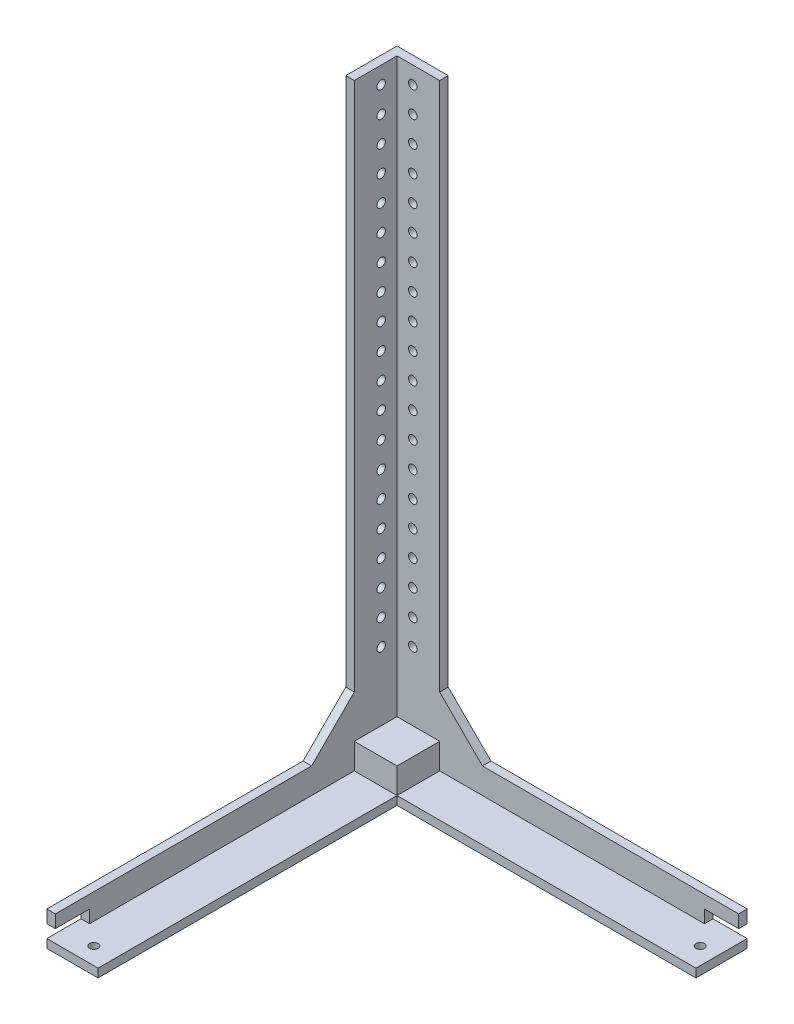
from build123d import *

# Parameters (mm, degrees)
EXTRUDE_2_DEPTH          = 10
EXTRUDE_3_DEPTH          = 40
EXTRUDE_4_DEPTH          = 700
SKETCH_13_W              = 60
SKETCH_13_H              = 60
EXTRUDE_7_DEPTH          = 30
EXTRUDE_1_DEPTH          = 40
EXTRUDE_8_DEPTH          = 10
EXTRUDE_9_DEPTH          = 10
SKETCH_36_R              = 5
CUT_EXTRUDE_1_DEPTH      = 10
PATTERN_LINEAR_1_COUNT   = 20
PATTERN_LINEAR_1_PITCH   = 30
SKETCH_37_R              = 5
CUT_EXTRUDE_2_DEPTH      = 10
PATTERN_LINEAR_2_COUNT   = 20
PATTERN_LINEAR_2_PITCH   = 30
CUT_EXTRUDE_3_DEPTH      = 901
CUT_EXTRUDE_3_DEPTH_BACK = 901
SKETCH_38_R              = 5
SKETCH_39_W              = 10
SKETCH_39_H              = 15
CUT_EXTRUDE_4_DEPTH      = 40
SKETCH_40_W              = 10
SKETCH_40_H              = 15
CUT_EXTRUDE_5_DEPTH      = 40


# Read off the part's stored shape, not the designer's step: 拉伸-薄壁1
with BuildPart() as part:
    # 草图3 → 凸台-拉伸2 (new body)
    with BuildSketch(Plane(origin=(0, 0, 0), x_dir=(1, 0, 0), z_dir=(0, 1, 0))):
        Polygon((0, 0), (0, -400), (50, -400), (50, -50), (400, -50), (400, 0), align=None)
    extrude(amount=EXTRUDE_2_DEPTH)

    # 草图4 → 凸台-拉伸3 (add)
    with BuildSketch(Plane(origin=(0, 0, 0), x_dir=(1, 0, 0), z_dir=(0, 1, 0))):
        Polygon((0, -400), (-10, -400), (-10, 10), (400, 10), (400, 0), (0, 0), align=None)
    extrude(amount=EXTRUDE_3_DEPTH)

    # 草图6 → 凸台-拉伸4 (add)
    with BuildSketch(Plane(origin=(0, 10, 0), x_dir=(1, 0, 0), z_dir=(0, 1, 0))):
        Polygon((-10, 10), (-10, -50), (0, -50), (0, 0), (50, 0), (50, 10), align=None)
    extrude(amount=EXTRUDE_4_DEPTH)

    # 草图13 → 凸台-拉伸7 (add)
    with BuildSketch(Plane(origin=(0, 10, 0), x_dir=(1, 0, 0), z_dir=(0, 1, 0))):
        with Locations((20, -20)):
            Rectangle(SKETCH_13_W, SKETCH_13_H)
    extrude(amount=EXTRUDE_7_DEPTH)

    # 拉伸-薄壁1 outline → 拉伸-薄壁1 (add)
    with BuildSketch(Plane(origin=(0, 0, 0), x_dir=(1, 0, 0), z_dir=(0, 1, 0))):
        with BuildLine():
            Line((-10, 10), (50, 10))
            Line((50, 10), (50, 20))
            Line((50, 20), (-10, 20))
            ThreePointArc((-10, 20), (-17.071067812, 17.071067812), (-20, 10))
            Line((-20, 10), (-20, -50))
            Line((-20, -50), (-10, -50))
            Line((-10, -50), (-10, 10))
        make_face()
    extrude(amount=EXTRUDE_1_DEPTH)

    # 草图34 → 凸台-拉伸8 (add)
    with BuildSketch(Plane(origin=(0, 0, -10), x_dir=(-1, 0, 0), z_dir=(0, 0, -1))):
        Polygon((-100, 40), (-50, 90), (-50, 40), align=None)
    extrude(amount=-EXTRUDE_8_DEPTH)

    # 草图35 → 凸台-拉伸9 (add)
    with BuildSketch(Plane.ZY.offset(10)):
        Polygon((50, 90), (50, 40), (100, 40), align=None)
    extrude(amount=-EXTRUDE_9_DEPTH)

    # 草图36 → 切除-拉伸1 (cut)
    with BuildSketch(Plane(origin=(0, 0, 0), x_dir=(0, 0, -1), z_dir=(1, 0, 0))):
        with Locations((-18.5, 690)):
            Circle(SKETCH_36_R)
    cut_extrude_1 = extrude(amount=-CUT_EXTRUDE_1_DEPTH, mode=Mode.SUBTRACT)

    # 阵列(线性)1: 切除-拉伸1 ×20
    with Locations(*[(0, -i * PATTERN_LINEAR_1_PITCH, 0) for i in range(1, PATTERN_LINEAR_1_COUNT)]):
        add(cut_extrude_1, mode=Mode.SUBTRACT)

    # 草图37 → 切除-拉伸2 (cut)
    with BuildSketch(Plane.XY):
        with Locations((18.5, 690)):
            Circle(SKETCH_37_R)
    cut_extrude_2 = extrude(amount=-CUT_EXTRUDE_2_DEPTH, mode=Mode.SUBTRACT)

    # 阵列(线性)2: 切除-拉伸2 ×20
    with Locations(*[(0, -i * PATTERN_LINEAR_2_PITCH, 0) for i in range(1, PATTERN_LINEAR_2_COUNT)]):
        add(cut_extrude_2, mode=Mode.SUBTRACT)

    # 草图38 → 切除-拉伸3 (cut, two sides: drawn at the far end of the back side and taken through both)
    with BuildSketch(Plane(origin=(0, 10, 0), x_dir=(1, 0, 0), z_dir=(0, 1, 0)).offset(-CUT_EXTRUDE_3_DEPTH_BACK)):
        with Locations(Location((25, -380, 0), (0, 0, 270))):
            Circle(SKETCH_38_R)
        with Locations(Location((380, -25, 0), (0, 0, 270))):
            Circle(SKETCH_38_R)
    extrude(amount=CUT_EXTRUDE_3_DEPTH + CUT_EXTRUDE_3_DEPTH_BACK, mode=Mode.SUBTRACT)

    # 草图39 → 切除-拉伸4 (cut)
    with BuildSketch(Plane.XY.offset(400)):
        with Locations((-5, 17.5)):
            Rectangle(SKETCH_39_W, SKETCH_39_H)
    extrude(amount=-CUT_EXTRUDE_4_DEPTH, mode=Mode.SUBTRACT)

    # 草图40 → 切除-拉伸5 (cut)
    with BuildSketch(Plane(origin=(400, 0, 0), x_dir=(0, 0, -1), z_dir=(1, 0, 0))):
        with Locations((5, 17.5)):
            Rectangle(SKETCH_40_W, SKETCH_40_H)
    extrude(amount=-CUT_EXTRUDE_5_DEPTH, mode=Mode.SUBTRACT)


solid = part.part
